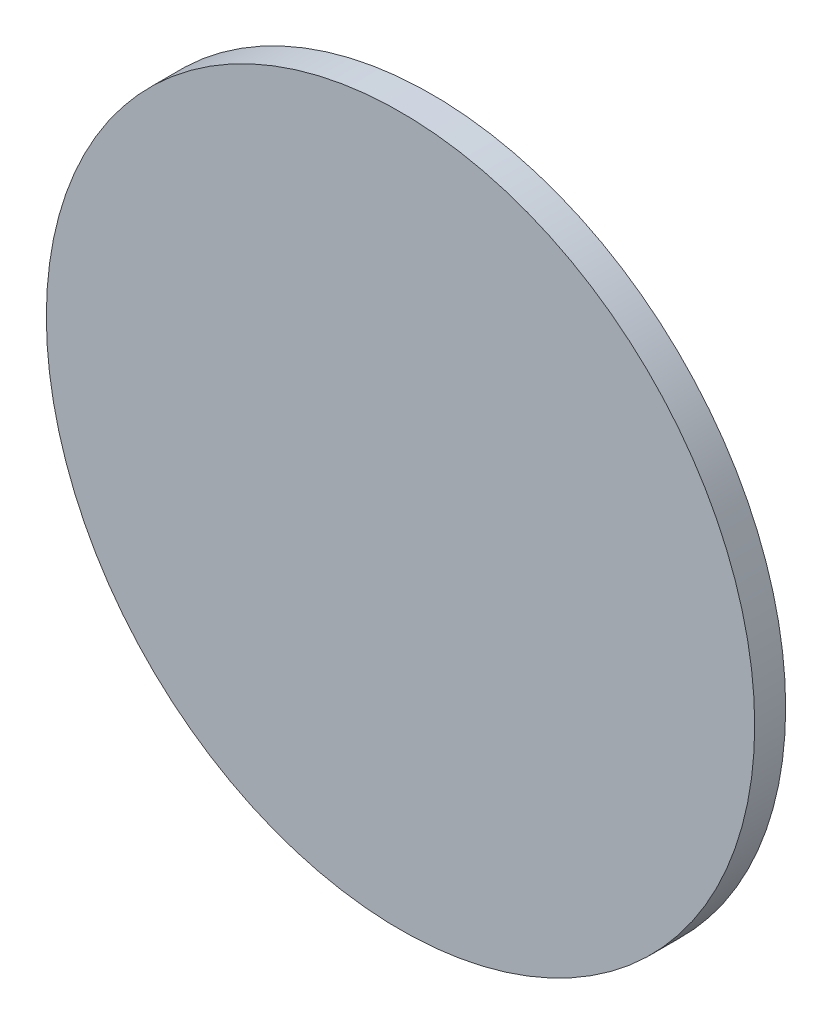
from build123d import *

# Parameters (mm, degrees)
SKETCH1_R           = 36.3093
BOSS_EXTRUDE1_DEPTH = 3.175


with BuildPart() as part:
    # Sketch1 → Boss-Extrude1 (new body)
    with BuildSketch(Plane.XY):
        Circle(SKETCH1_R)
    extrude(amount=BOSS_EXTRUDE1_DEPTH)


solid = part.part
